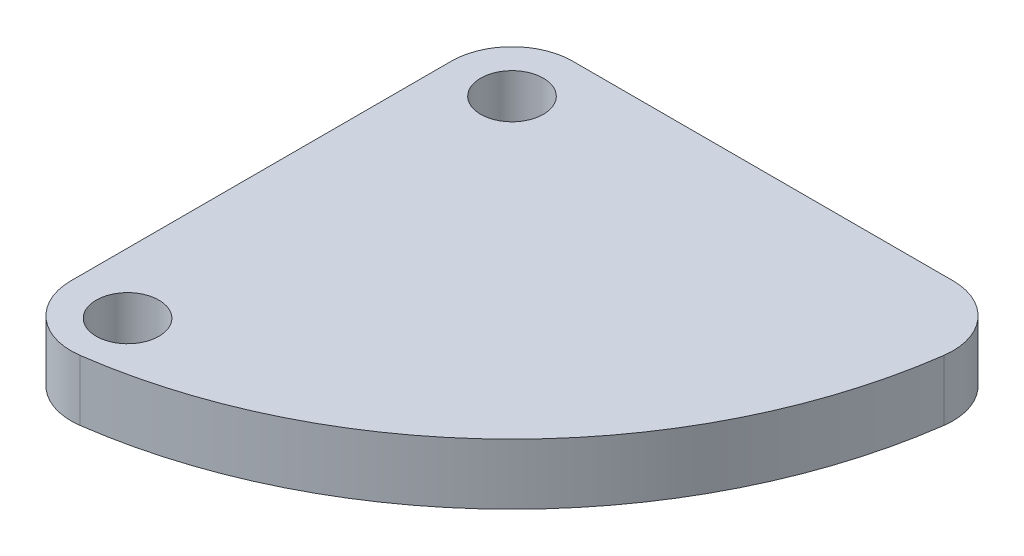
from build123d import *

# Parameters (mm, degrees)
SKETCH1_W           = 25
SKETCH1_H           = 25
SKETCH1_R           = 1.55
BOSS_EXTRUDE1_DEPTH = 3
FILLET1_R           = 25
FILLET2_R           = 3


with BuildPart() as part:
    # Sketch1 → Boss-Extrude1 (new body)
    with BuildSketch(Plane(origin=(0, 0, 0), x_dir=(1, 0, 0), z_dir=(0, 1, 0))):
        Rectangle(SKETCH1_W, SKETCH1_H)
        with Locations(Location((-9.5, 9.5, 0), (0, 0, 270))):
            Circle(SKETCH1_R, mode=Mode.SUBTRACT)
        with Locations(Location((-9.5, -9.5, 0), (0, 0, 270))):
            Circle(SKETCH1_R, mode=Mode.SUBTRACT)
    extrude(amount=-BOSS_EXTRUDE1_DEPTH)

    # Fillet1
    fillet1_edges = [part.edges().sort_by_distance(p)[0] for p in [
        (12.5, -1.5, 12.5),
    ]]
    fillet(fillet1_edges, radius=FILLET1_R - 0.0001)  # a hair under: the kernel refuses the full size

    # Fillet2
    fillet2_edges = [part.edges().sort_by_distance(p)[0] for p in [
        (-12.5, -1.5, 12.5),
        (-12.5, -1.5, -12.5),
        (12.5, -1.5, -12.5),
    ]]
    fillet(fillet2_edges, radius=FILLET2_R)


solid = part.part
